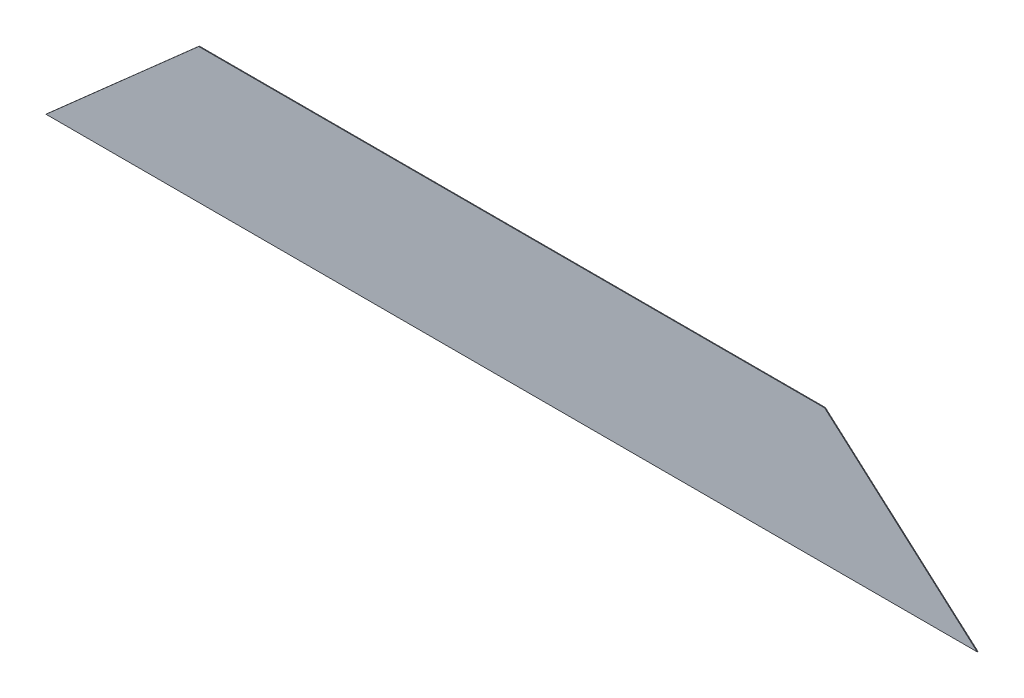
from build123d import *

# Parameters (mm, degrees)
BRIDA_BASE1_DEPTH = 1.5875


# Sheet-metal steps are written as plain solids
with BuildPart() as part:
    # Croquis1 → Brida base1 (new body)
    with BuildSketch(Plane.XY):
        Polygon((-1050.4, -140.112293651), (-706, 164.487706349), (706, 164.487706349), (1050.4, -140.112293651), align=None)
    extrude(amount=-BRIDA_BASE1_DEPTH)


solid = part.part
